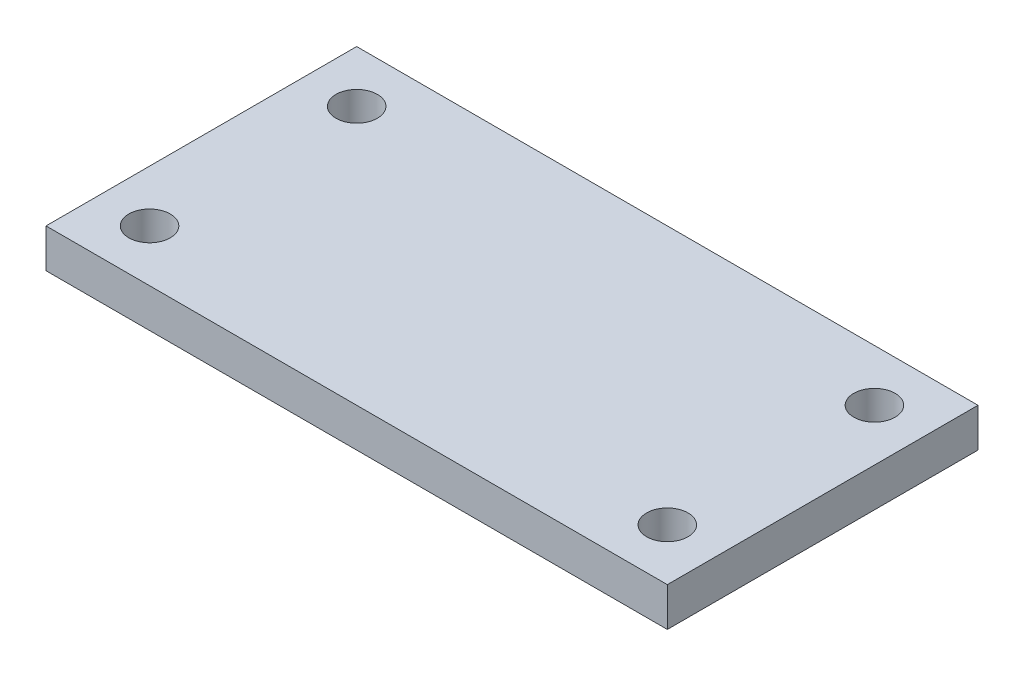
from build123d import *

# Parameters (mm, degrees)
SKETCH1_W           = 76.2
SKETCH1_H           = 38.1
BOSS_EXTRUDE1_DEPTH = 4.7625
SKETCH2_R           = 2.54
CUT_EXTRUDE1_DEPTH  = 4.7625


with BuildPart() as part:
    # Sketch1 → Boss-Extrude1 (new body)
    with BuildSketch(Plane(origin=(0, 0, 0), x_dir=(1, 0, 0), z_dir=(0, 1, 0))):
        Rectangle(SKETCH1_W, SKETCH1_H)
    extrude(amount=BOSS_EXTRUDE1_DEPTH)

    # Sketch2 → Cut-Extrude1 (cut)
    with BuildSketch(Plane(origin=(0, 4.7625, 0), x_dir=(1, 0, 0), z_dir=(0, 1, 0))):
        with Locations((-31.75, 12.7)):
            Circle(SKETCH2_R)
        with Locations((-31.75, -12.7)):
            Circle(SKETCH2_R)
        with Locations((31.75, -12.7)):
            Circle(SKETCH2_R)
        with Locations((31.75, 12.7)):
            Circle(SKETCH2_R)
    extrude(amount=-CUT_EXTRUDE1_DEPTH, mode=Mode.SUBTRACT)


solid = part.part
